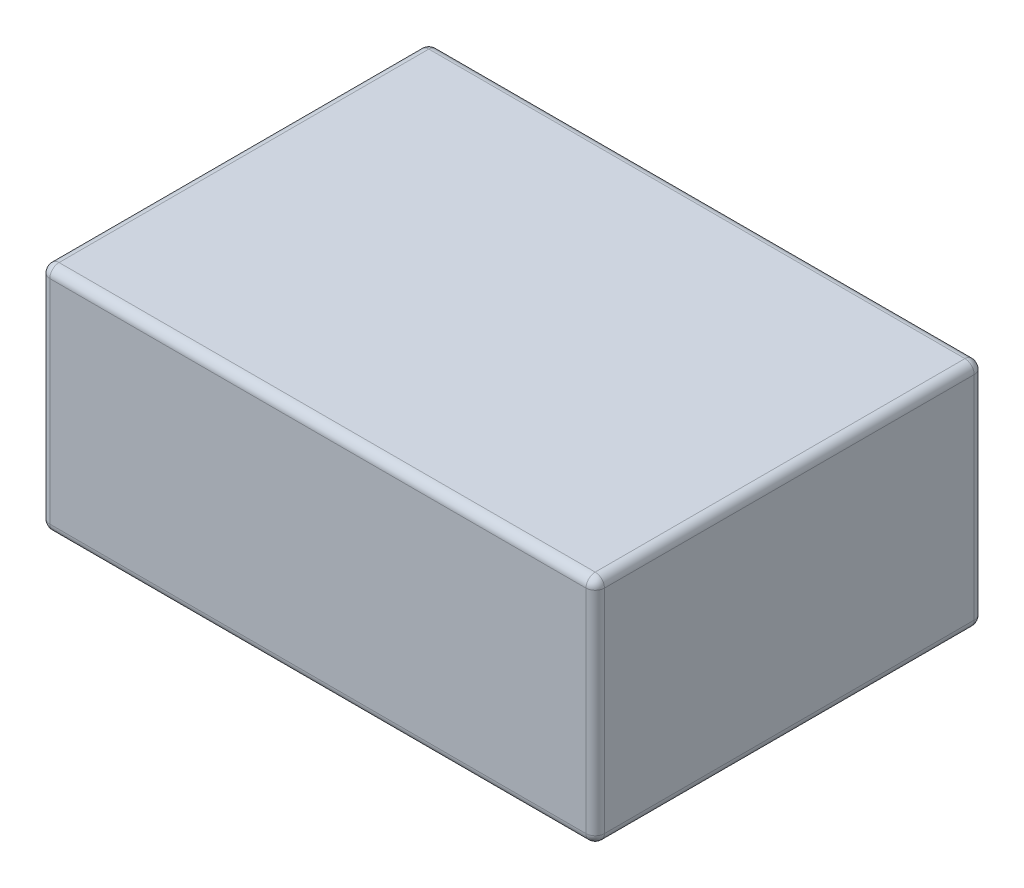
from build123d import *

# Parameters (mm, degrees)
SKETCH4_W                = 120
SKETCH4_H                = 84
BOSS_EXTRUDE2_DEPTH      = 50
BOSS_EXTRUDE4_DEPTH      = 48
BOSS_EXTRUDE4_DEPTH_BACK = 5.717293385
SKETCH5_W                = 116
SKETCH5_H                = 67
FILLET2_R                = 2
FILLET3_R                = 2


# Some blends are built 0.0001 mm under size
with BuildPart() as part:
    # Sketch4 → Boss-Extrude2 (new body)
    with BuildSketch(Plane(origin=(0, 0, 0), x_dir=(1, 0, 0), z_dir=(0, 1, 0))):
        with Locations((60, 42)):
            Rectangle(SKETCH4_W, SKETCH4_H)
    extrude(amount=BOSS_EXTRUDE2_DEPTH)


with BuildPart() as body_2:
    # Sketch5 → Boss-Extrude4 (new, two sides: drawn at the far end of the back side and taken through both)
    with BuildSketch(Plane(origin=(0, 0, 0), x_dir=(1, 0, 0), z_dir=(0, 1, 0)).offset(-BOSS_EXTRUDE4_DEPTH_BACK)):
        with Locations((60, 35.5)):
            Rectangle(SKETCH5_W, SKETCH5_H)
    extrude(amount=BOSS_EXTRUDE4_DEPTH + BOSS_EXTRUDE4_DEPTH_BACK)


with BuildPart() as part_1:
    add(part.part)

    # Combine1: cut body 2
    add(body_2.part, mode=Mode.SUBTRACT)

    # Fillet2
    fillet2_edges = [part_1.edges().sort_by_distance(p)[0] for p in [
        (0, 0, -42),
        (60, 0, -84),
        (120, 0, -42),
        (60, 0, 0),
    ]]
    fillet(fillet2_edges, radius=FILLET2_R - 0.0001)  # a hair under: the kernel refuses the full size

    # Fillet3
    # the kernel refuses this fillet: 2 mm, written as the material it takes off along each edge
    with BuildSketch(Plane(origin=(118, 0, -2), x_dir=(1, 0, 0), z_dir=(0, 0, -1))) as fillet3_piece_1:
        with BuildLine():
            CenterArc((0.0001, -1.9999), 1.9999, 0, 90)
            Line((2, -1.9999), (2, 0))
            Line((2, 0), (0.0001, 0))
        make_face()
    revolve(axis=Axis((118, 0, -2), (0, -1, 0)), revolution_arc=90, mode=Mode.SUBTRACT)
    with BuildSketch(Plane(origin=(118, 0, -82), x_dir=(0, 0, -1), z_dir=(-1, 0, 0))) as fillet3_piece_2:
        with BuildLine():
            CenterArc((0.0001, -1.9999), 1.9999, 0, 90)
            Line((2, -1.9999), (2, 0))
            Line((2, 0), (0.0001, 0))
        make_face()
    revolve(axis=Axis((118, 0, -82), (0, -1, 0)), revolution_arc=90, mode=Mode.SUBTRACT)
    with BuildSketch(Plane(origin=(2, 0, -2), x_dir=(0, 0, 1), z_dir=(1, 0, 0))) as fillet3_piece_3:
        with BuildLine():
            CenterArc((0.0001, -1.9999), 1.9999, 0, 90)
            Line((2, -1.9999), (2, 0))
            Line((2, 0), (0.0001, 0))
        make_face()
    revolve(axis=Axis((2, 0, -2), (0, -1, 0)), revolution_arc=90, mode=Mode.SUBTRACT)
    with BuildSketch(Plane(origin=(2, 0, -82), x_dir=(-1, 0, 0), z_dir=(0, 0, 1))) as fillet3_piece_4:
        with BuildLine():
            CenterArc((0.0001, -1.9999), 1.9999, 0, 90)
            Line((2, -1.9999), (2, 0))
            Line((2, 0), (0.0001, 0))
        make_face()
    revolve(axis=Axis((2, 0, -82), (0, -1, 0)), revolution_arc=90, mode=Mode.SUBTRACT)
    with BuildSketch(Plane(origin=(118, 48, -82), x_dir=(1, 0, 0), z_dir=(0, 1, 0))) as fillet3_piece_5_section:
        Polygon((0, 0), (FILLET3_R, 0), (FILLET3_R, FILLET3_R), (0, FILLET3_R), align=None)
    fillet3_piece_5 = extrude(amount=FILLET3_R, mode=Mode.PRIVATE)
    fillet3_piece_5 = fillet3_piece_5 - Plane(origin=(118, 48, -82), x_dir=(-0.7071067811865475, 0, 0.7071067811865475), z_dir=(0, 1, 0)) * Sphere(FILLET3_R, mode=Mode.PRIVATE)
    add(fillet3_piece_5, mode=Mode.SUBTRACT)
    with BuildSketch(Plane(origin=(2, 48, -82), x_dir=(0, 1, 0), z_dir=(-1, 0, 0))) as fillet3_piece_6_section:
        Polygon((0, 0), (FILLET3_R, 0), (FILLET3_R, FILLET3_R), (0, FILLET3_R), align=None)
    fillet3_piece_6 = extrude(amount=FILLET3_R, mode=Mode.PRIVATE)
    fillet3_piece_6 = fillet3_piece_6 - Plane(origin=(2, 48, -82), x_dir=(0, -0.7071067811865475, 0.7071067811865475), z_dir=(-1, 0, 0)) * Sphere(FILLET3_R, mode=Mode.PRIVATE)
    add(fillet3_piece_6, mode=Mode.SUBTRACT)
    with BuildSketch(Plane(origin=(2, 48, -2), x_dir=(-1, 0, 0), z_dir=(0, 0, 1))) as fillet3_piece_7_section:
        Polygon((0, 0), (FILLET3_R, 0), (FILLET3_R, -FILLET3_R), (0, -FILLET3_R), align=None)
    fillet3_piece_7 = extrude(amount=FILLET3_R, mode=Mode.PRIVATE)
    fillet3_piece_7 = fillet3_piece_7 - Plane(origin=(2, 48, -2), x_dir=(0.7071067811865475, -0.7071067811865475, 0), z_dir=(0, 0, 1)) * Sphere(FILLET3_R, mode=Mode.PRIVATE)
    add(fillet3_piece_7, mode=Mode.SUBTRACT)
    with BuildSketch(Plane(origin=(118, 48, -2), x_dir=(0, 1, 0), z_dir=(0, 0, 1))) as fillet3_piece_8_section:
        Polygon((0, 0), (FILLET3_R, 0), (FILLET3_R, -FILLET3_R), (0, -FILLET3_R), align=None)
    fillet3_piece_8 = extrude(amount=FILLET3_R, mode=Mode.PRIVATE)
    fillet3_piece_8 = fillet3_piece_8 - Plane(origin=(118, 48, -2), x_dir=(-0.7071067811865475, -0.7071067811865475, 0), z_dir=(0, 0, 1)) * Sphere(FILLET3_R, mode=Mode.PRIVATE)
    add(fillet3_piece_8, mode=Mode.SUBTRACT)
    with BuildSketch(Plane(origin=(118, 50, -84), x_dir=(0, 0, 1), z_dir=(-1, 0, 0))) as fillet3_piece_9:
        with BuildLine():
            CenterArc((FILLET3_R, -FILLET3_R), FILLET3_R, 90, 90)
            Line((0, -FILLET3_R), (0, 0))
            Line((0, 0), (FILLET3_R, 0))
        make_face()
    extrude(amount=116, mode=Mode.SUBTRACT)
    with BuildSketch(Plane(origin=(0, 50, -82), x_dir=(0, -1, 0), z_dir=(0, 0, 1))) as fillet3_piece_10:
        with BuildLine():
            CenterArc((FILLET3_R, FILLET3_R), FILLET3_R, 180, 90)
            Line((0, FILLET3_R), (0, 0))
            Line((0, 0), (FILLET3_R, 0))
        make_face()
    extrude(amount=80, mode=Mode.SUBTRACT)
    with BuildSketch(Plane(origin=(2, 50, 0), x_dir=(0, -1, 0), z_dir=(1, 0, 0))) as fillet3_piece_11:
        with BuildLine():
            CenterArc((FILLET3_R, FILLET3_R), FILLET3_R, 180, 90)
            Line((0, FILLET3_R), (0, 0))
            Line((0, 0), (FILLET3_R, 0))
        make_face()
    extrude(amount=116, mode=Mode.SUBTRACT)
    with BuildSketch(Plane(origin=(0, 0, 0), x_dir=(1, 0, 0), z_dir=(0, 1, 0)), Plane(origin=(0, 0, -84), x_dir=(0, 0, 1), z_dir=(0, 1, 0))) as fillet3_piece_12:
        with BuildLine():
            CenterArc((FILLET3_R, FILLET3_R), FILLET3_R, 180, 90)
            Line((0, FILLET3_R), (0, 0))
            Line((0, 0), (FILLET3_R, 0))
        make_face()
    extrude(amount=48, mode=Mode.SUBTRACT)
    with BuildSketch(Plane(origin=(120, 0, -84), x_dir=(0, 0, 1), z_dir=(0, 1, 0)), Plane(origin=(120, 0, 0), x_dir=(-1, 0, 0), z_dir=(0, 1, 0))) as fillet3_piece_13:
        with BuildLine():
            CenterArc((FILLET3_R, -FILLET3_R), FILLET3_R, 90, 90)
            Line((0, -FILLET3_R), (0, 0))
            Line((0, 0), (FILLET3_R, 0))
        make_face()
    extrude(amount=48, mode=Mode.SUBTRACT)
    with BuildSketch(Plane(origin=(120, 50, -2), x_dir=(-1, 0, 0), z_dir=(0, 0, -1))) as fillet3_piece_14:
        with BuildLine():
            CenterArc((FILLET3_R, -FILLET3_R), FILLET3_R, 90, 90)
            Line((0, -FILLET3_R), (0, 0))
            Line((0, 0), (FILLET3_R, 0))
        make_face()
    extrude(amount=80, mode=Mode.SUBTRACT)


solid = part_1.part
